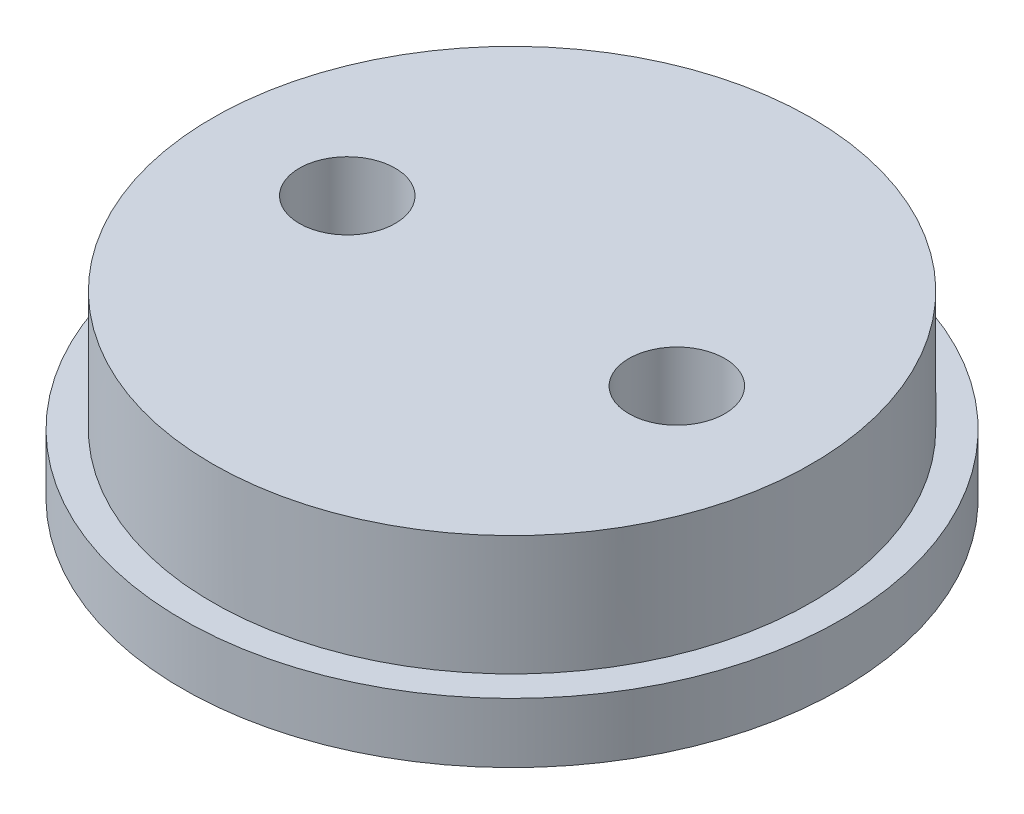
from build123d import *

# Parameters (mm, degrees)
SKETCH1_R           = 10
BOSS_EXTRUDE1_DEPTH = 6
SKETCH4_R           = 11
BOSS_EXTRUDE2_DEPTH = 2
SKETCH3_R           = 1.6
CUT_EXTRUDE2_DEPTH  = 15


with BuildPart() as part:
    # Sketch1 → Boss-Extrude1 (new body)
    with BuildSketch(Plane(origin=(0, 0, 0), x_dir=(1, 0, 0), z_dir=(0, 1, 0))):
        Circle(SKETCH1_R)
    extrude(amount=BOSS_EXTRUDE1_DEPTH)

    # Sketch4 → Boss-Extrude2 (add)
    with BuildSketch(Plane.XZ):
        Circle(SKETCH4_R)
    extrude(amount=-BOSS_EXTRUDE2_DEPTH)

    # Sketch3 → Cut-Extrude2 (cut)
    with BuildSketch(Plane(origin=(0, 0, 0), x_dir=(1, 0, 0), z_dir=(0, 1, 0))):
        with Locations((-5.5, 0)):
            Circle(SKETCH3_R)
        with Locations((5.5, 0)):
            Circle(SKETCH3_R)
    extrude(amount=CUT_EXTRUDE2_DEPTH, mode=Mode.SUBTRACT)


solid = part.part
